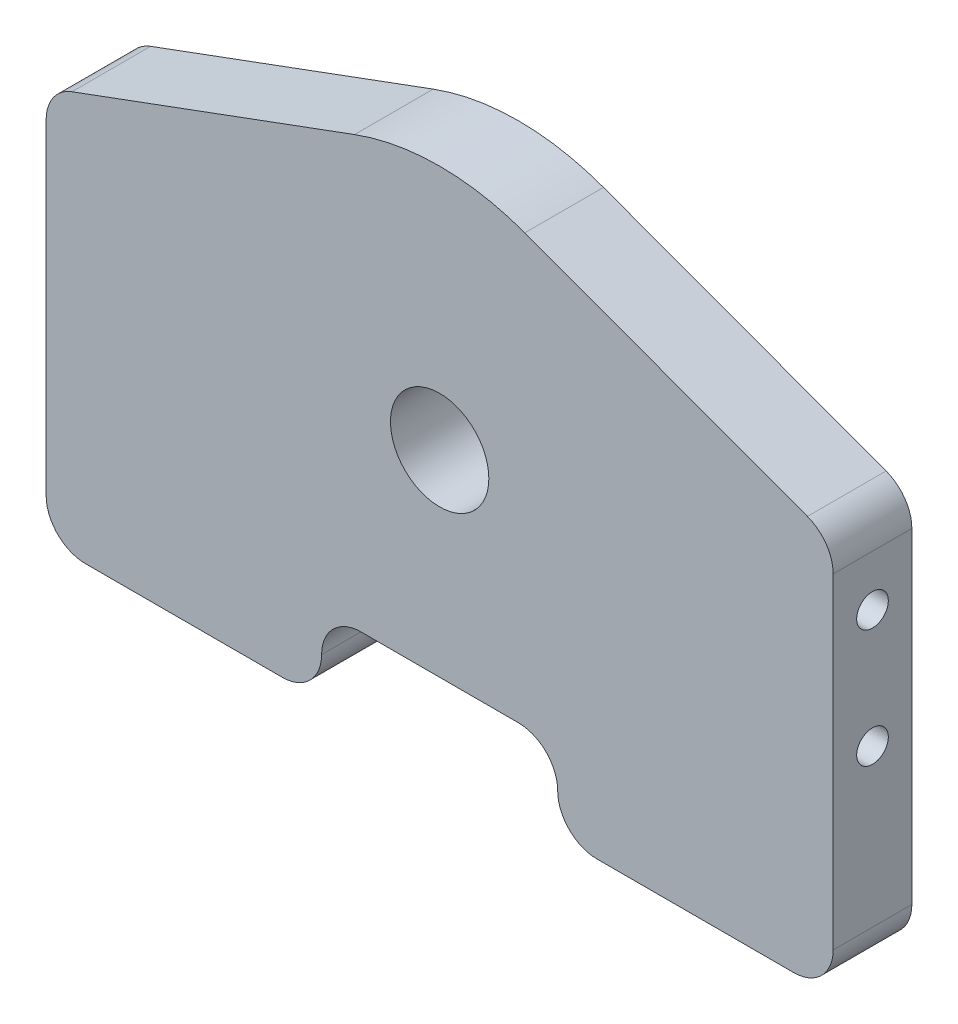
from build123d import *

# Parameters (mm, degrees)
SKETCH1_W                        = 127
SKETCH1_H                        = 152.4
BOSS_EXTRUDE1_DEPTH              = 12.7
SKETCH2_R                        = 7.9375
CUT_EXTRUDE1_DEPTH               = 166.587741092
F_1_4_20_TAPPED_HOLE1_AT_2_COUNT = 2
F_1_4_20_TAPPED_HOLE1_AT_2_PITCH = 19.05
SKETCH5_W                        = 38.1
SKETCH5_H                        = 12.7
CUT_EXTRUDE2_DEPTH               = 107.172778556
FILLET1_R                        = 6.35


with BuildPart() as part:
    # Sketch1 → Boss-Extrude1 (new body)
    with BuildSketch(Plane.XY):
        with Locations((0, 76.2)):
            Rectangle(SKETCH1_W, SKETCH1_H)
    extrude(amount=BOSS_EXTRUDE1_DEPTH)

    # Sketch2 → Cut-Extrude1 (cut, through all)
    with BuildSketch(Plane.XY.offset(12.7)):
        with BuildLine():
            Line((-63.5, 152.4), (-63.5, 63.327000238))
            Line((-63.5, 63.327000238), (-13.735698541, 81.684771946))
            ThreePointArc((-13.735698541, 81.684771946), (0, 84.1375), (13.735698541, 81.684771946))
            Line((13.735698541, 81.684771946), (63.5, 63.327000238))
            Line((63.5, 63.327000238), (63.5, 152.4))
            Line((63.5, 152.4), (-63.5, 152.4))
        make_face()
        with Locations((0, 44.45)):
            Circle(SKETCH2_R)
    extrude(amount=-CUT_EXTRUDE1_DEPTH, mode=Mode.SUBTRACT)

    # Sketch3 → 1/4-20 Tapped Hole1 (revolve, cut)
    with BuildSketch(Plane(origin=(63.5, 50.713500119, 6.35), x_dir=(0, 0, -1), z_dir=(0, 1, 0))):
        Polygon((0, 0), (0, 18.043816902), (2.5527, 16.51), (2.5527, 0), align=None)
    f_1_4_20_tapped_hole1 = revolve(axis=Axis((69.85, 50.713500119, 6.35), (-1, 0, 0)), mode=Mode.SUBTRACT)

    # 1/4-20 Tapped Hole1 at 2: 1/4-20 Tapped Hole1 ×2
    with Locations(*[(0, -i * F_1_4_20_TAPPED_HOLE1_AT_2_PITCH, 0) for i in range(1, F_1_4_20_TAPPED_HOLE1_AT_2_COUNT)]):
        add(f_1_4_20_tapped_hole1, mode=Mode.SUBTRACT)

    # Mirror1: 1/4-20 Tapped Hole1 across plane
    add(f_1_4_20_tapped_hole1.mirror(Plane(origin=(0, 0, 0), x_dir=(0, 0, 1), z_dir=(1, 0, 0))), mode=Mode.SUBTRACT)

    # Mirror1 copy 1 sketch → Mirror1 copy 1 (revolve, cut)
    with BuildSketch(Plane(origin=(-63.5, 31.663500119, 6.35), x_dir=(0, 0, -1), z_dir=(0, 1, 0))):
        Polygon((0, 0), (0, -18.043816902), (2.5527, -16.51), (2.5527, 0), align=None)
    revolve(axis=Axis((-69.85, 31.663500119, 6.35), (-1, 0, 0)), mode=Mode.SUBTRACT)

    # Sketch5 → Cut-Extrude2 (cut, through all)
    with BuildSketch(Plane.XY.offset(12.7)):
        with Locations((0, 6.35)):
            Rectangle(SKETCH5_W, SKETCH5_H)
    extrude(amount=-CUT_EXTRUDE2_DEPTH, mode=Mode.SUBTRACT)

    # Fillet1
    fillet1_edges = [part.edges().sort_by_distance(p)[0] for p in [
        (-19.05, 12.7, 6.35),
        (19.05, 12.7, 6.35),
        (19.05, 0, 6.35),
        (63.5, 0, 6.35),
        (63.5, 63.327000238, 6.35),
        (-63.5, 0, 6.35),
        (-19.05, 0, 6.35),
        (-63.5, 63.327000238, 6.35),
    ]]
    fillet(fillet1_edges, radius=FILLET1_R - 0.0001)  # a hair under: the kernel refuses the full size


solid = part.part
